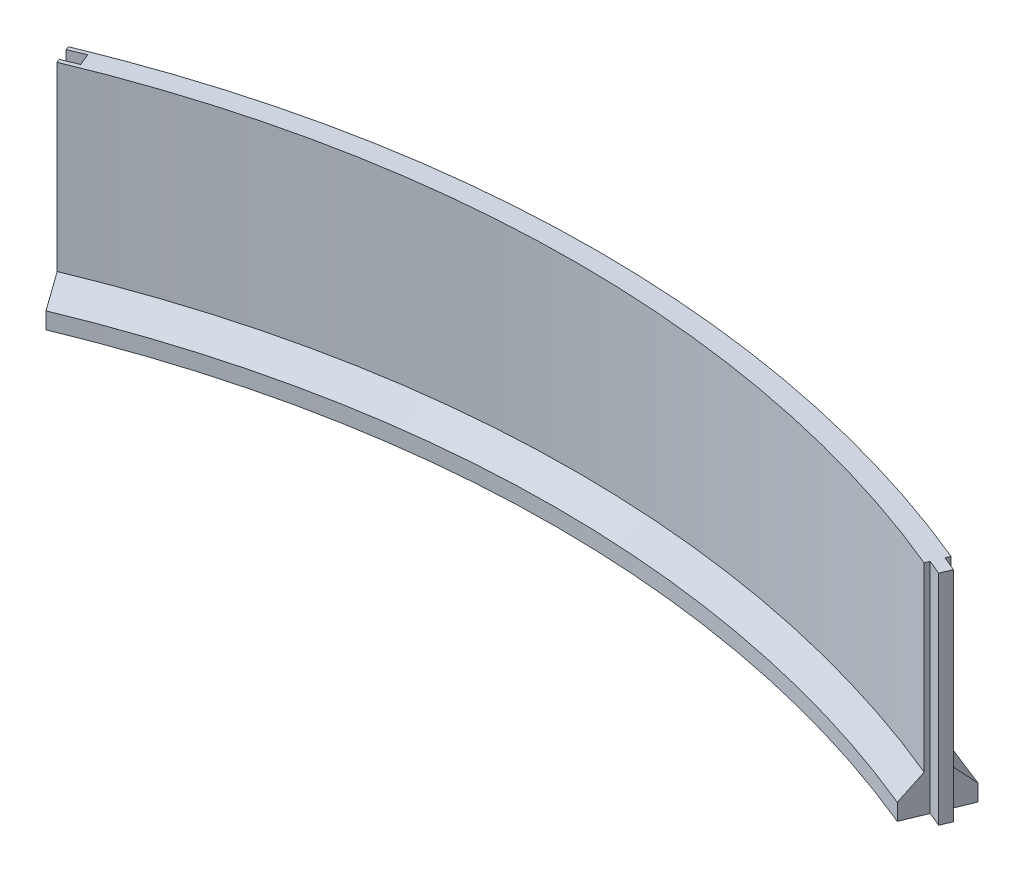
from build123d import *

# Parameters (mm, degrees)
BOSS_EXTRUDE1_DEPTH = 13.25
BOSS_EXTRUDE2_START = -2
BOSS_EXTRUDE2_DEPTH = 2
CHAMFER2_SIZE       = 2.5


with BuildPart() as part:
    # Sketch2 → Boss-Extrude1 (new, symmetric)
    with BuildSketch(Plane(origin=(0, 0, 0), x_dir=(1, 0, 0), z_dir=(0, 1, 0))):
        with BuildLine():
            Line((-52.61897195, 127.03343572), (-52.795575656, 127.459794782))
            Line((-52.795575656, 127.459794782), (-50.947816591, 128.225161647))
            Line((-50.947816591, 128.225161647), (-51.55131776, 129.682142355))
            Line((-51.55131776, 129.682142355), (-53.399076825, 128.91677549))
            Line((-53.399076825, 128.91677549), (-53.575680531, 129.343134552))
            ThreePointArc((-53.575680531, 129.343134552), (0, 140), (53.575680531, 129.343134552))
            Line((53.575680531, 129.343134552), (53.399076825, 128.91677549))
            Line((53.399076825, 128.91677549), (53.360808482, 128.824387537))
            Line((53.360808482, 128.824387537), (55.116179594, 128.097289015))
            Line((55.116179594, 128.097289015), (54.589215111, 126.825084214))
            Line((54.589215111, 126.825084214), (52.833843999, 127.552182735))
            Line((52.833843999, 127.552182735), (52.795575656, 127.459794782))
            Line((52.795575656, 127.459794782), (52.61897195, 127.03343572))
            ThreePointArc((52.61897195, 127.03343572), (0, 137.5), (-52.61897195, 127.03343572))
        make_face()
    extrude(amount=BOSS_EXTRUDE1_DEPTH, both=True)

    # Sketch3 → Boss-Extrude2 (add)
    with BuildSketch(Plane.XZ.offset(13.25).offset(BOSS_EXTRUDE2_START)):
        with BuildLine():
            ThreePointArc((53.575680531, -129.343134552), (0, -140), (-53.575680531, -129.343134552))
            Line((-53.575680531, -129.343134552), (-54.532389112, -131.652833383))
            ThreePointArc((-54.532389112, -131.652833383), (0, -142.5), (54.532389112, -131.652833383))
            Line((54.532389112, -131.652833383), (53.575680531, -129.343134552))
        make_face()
        with BuildLine():
            Line((-51.662263369, -124.723736889), (-52.61897195, -127.03343572))
            ThreePointArc((-52.61897195, -127.03343572), (0, -137.5), (52.61897195, -127.03343572))
            Line((52.61897195, -127.03343572), (51.662263369, -124.723736889))
            ThreePointArc((51.662263369, -124.723736889), (0, -135), (-51.662263369, -124.723736889))
        make_face()
    extrude(amount=BOSS_EXTRUDE2_DEPTH)

    # Chamfer2
    chamfer2_edges = [part.edges().sort_by_distance(p)[0] for p in [
        (0, -11.25, -137.5),
        (0, -11.25, -140),
    ]]
    chamfer(chamfer2_edges, length=CHAMFER2_SIZE - 0.0001)  # a hair under: the kernel refuses the full size


solid = part.part
